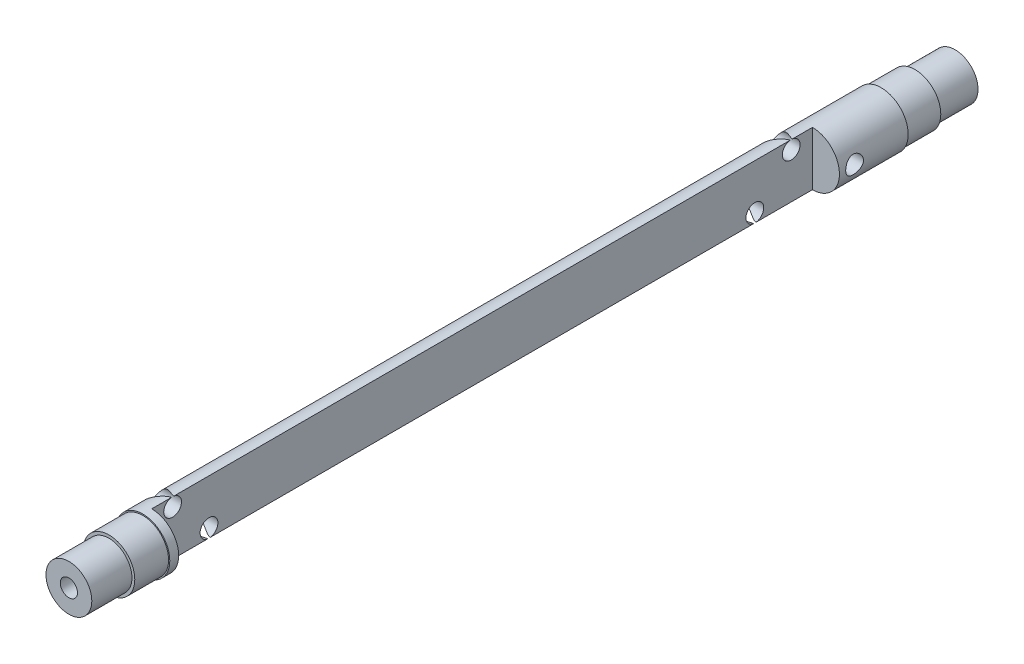
from build123d import *

# Parameters (mm, degrees)
SKETCH1_R               = 4.71
EXTRUDE1_DEPTH          = 128.85
SKETCH3_R               = 4.5
EXTRUDE3_DEPTH          = 5.9
SKETCH4_R               = 4
EXTRUDE4_DEPTH          = 7
EXTRUDE5_START          = 5.9
SKETCH5_R               = 4.5
EXTRUDE5_DEPTH          = 5.9
EXTRUDE6_START          = 7
SKETCH6_R               = 4
EXTRUDE6_DEPTH          = 7
SKETCH7_W               = 115.3
SKETCH7_H               = 9.42
CUT_EXTRUDE2_DEPTH      = 142.906415288
SKETCH8_R               = 1.55
CUT_EXTRUDE3_DEPTH      = 142.906415288
CUT_EXTRUDE4_DEPTH      = 142.906415295
CUT_EXTRUDE4_DEPTH_BACK = 142.906415295
SKETCH9_R               = 1.55
SKETCH10_R              = 1.5
CUT_EXTRUDE5_DEPTH      = 7
CUT_EXTRUDE6_START      = -7
SKETCH11_R              = 1.5
CUT_EXTRUDE6_DEPTH      = 7


with BuildPart() as part:
    # Sketch1 → Extrude1 (new body)
    with BuildSketch(Plane.XY):
        Circle(SKETCH1_R)
    extrude(amount=EXTRUDE1_DEPTH)

    # Sketch3 → Extrude3 (add)
    with BuildSketch(Plane.XY.offset(128.85)):
        Circle(SKETCH3_R)
    extrude(amount=EXTRUDE3_DEPTH)

    # Sketch4 → Extrude4 (add)
    with BuildSketch(Plane.XY.offset(134.75)):
        Circle(SKETCH4_R)
    extrude(amount=EXTRUDE4_DEPTH)

    # Sketch5 → Extrude5 (add)
    with BuildSketch(Plane(origin=(0, 0, 0), x_dir=(-1, 0, 0), z_dir=(0, 0, -1)).offset(EXTRUDE5_START)):
        Circle(SKETCH5_R)
    extrude(amount=-EXTRUDE5_DEPTH)

    # Sketch6 → Extrude6 (add)
    with BuildSketch(Plane(origin=(0, 0, -5.9), x_dir=(-1, 0, 0), z_dir=(0, 0, -1)).offset(EXTRUDE6_START)):
        Circle(SKETCH6_R)
    extrude(amount=-EXTRUDE6_DEPTH)

    # Sketch7 → Cut-Extrude2 (cut, through all)
    with BuildSketch(Plane(origin=(0, 0, 0), x_dir=(0, 0, -1), z_dir=(1, 0, 0))):
        with Locations((-69.65, 0)):
            Rectangle(SKETCH7_W, SKETCH7_H)
    extrude(amount=CUT_EXTRUDE2_DEPTH, mode=Mode.SUBTRACT)

    # Sketch8 → Cut-Extrude3 (cut, through all)
    with BuildSketch(Plane(origin=(0, 0, 0), x_dir=(0, 0, -1), z_dir=(1, 0, 0))):
        with Locations((-15.7, 3.175)):
            Circle(SKETCH8_R)
        with Locations((-22.05, -3.175)):
            Circle(SKETCH8_R)
        with Locations((-123.65, 3.175)):
            Circle(SKETCH8_R)
        with Locations((-117.3, -3.175)):
            Circle(SKETCH8_R)
    extrude(amount=-CUT_EXTRUDE3_DEPTH, mode=Mode.SUBTRACT)

    # Sketch9 → Cut-Extrude4 (cut, two sides: drawn at the far end of the back side and taken through both)
    with BuildSketch(Plane(origin=(0, 0, 0), x_dir=(0, 0, -1), z_dir=(1, 0, 0)).offset(-CUT_EXTRUDE4_DEPTH_BACK)):
        with Locations((-9.35, 0)):
            Circle(SKETCH9_R)
    extrude(amount=CUT_EXTRUDE4_DEPTH + CUT_EXTRUDE4_DEPTH_BACK, mode=Mode.SUBTRACT)

    # Sketch10 → Cut-Extrude5 (cut)
    with BuildSketch(Plane.XY.offset(141.75)):
        Circle(SKETCH10_R)
    extrude(amount=-CUT_EXTRUDE5_DEPTH, mode=Mode.SUBTRACT)

    # Sketch11 → Cut-Extrude6 (cut)
    with BuildSketch(Plane(origin=(0, 0, -12.9), x_dir=(-1, 0, 0), z_dir=(0, 0, -1)).offset(CUT_EXTRUDE6_START)):
        Circle(SKETCH11_R)
    extrude(amount=CUT_EXTRUDE6_DEPTH, mode=Mode.SUBTRACT)


solid = part.part
